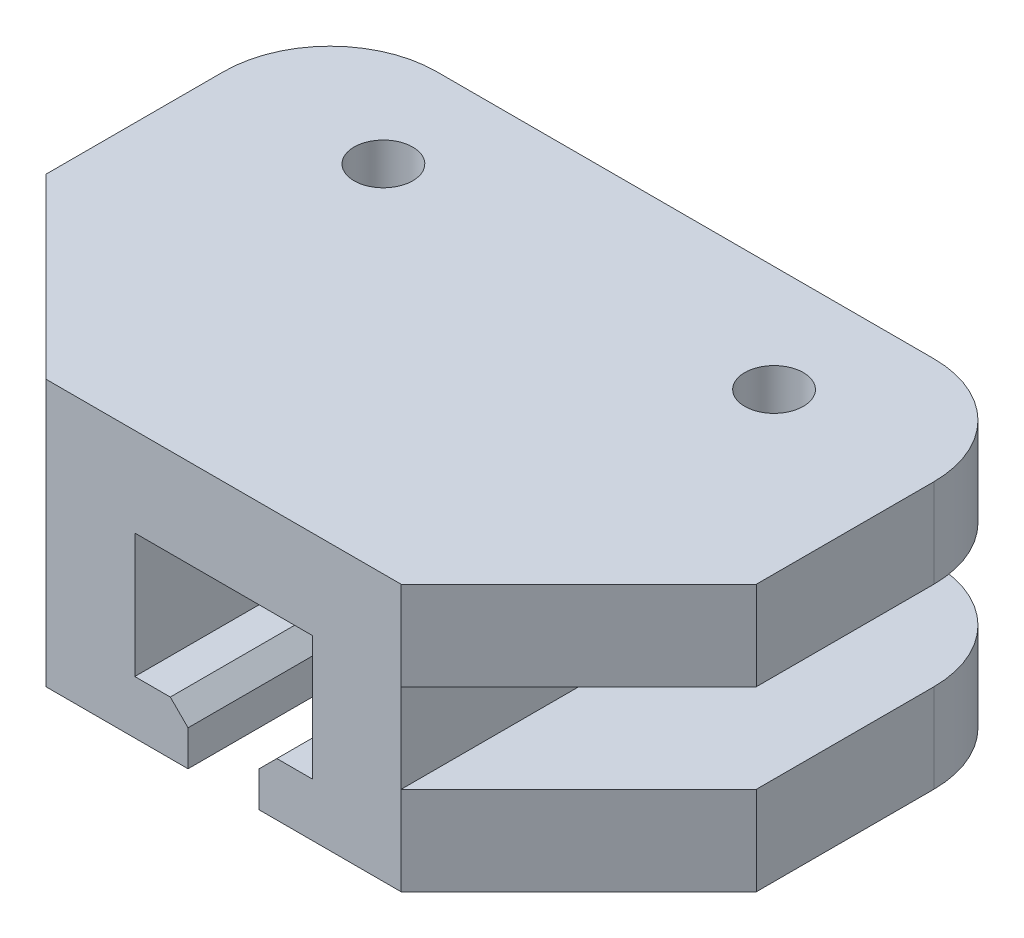
from build123d import *

# Parameters (mm, degrees)
SKETCH_1_W                = 20
SKETCH_1_H                = 20
SKETCH_1_W_2              = 10
SKETCH_1_H_2              = 10
EXTRUDE_1_DEPTH           = 30
EXTRUDE_1_2_DEPTH         = 20
EXTRUDE_1_2_DEPTH_BACK    = 40
SKETCH_2_W                = 20
SKETCH_2_H                = 20
SKETCH_5_W                = 20
SKETCH_5_H                = 10
CUT_EXTRUDE_1_DEPTH       = 35
SKETCH_6_R                = 1.5
CUT_EXTRUDE_2_DEPTH       = 35
SKETCH_7_W                = 10
SKETCH_7_H                = 10
CUT_EXTRUDE_3_DEPTH       = 35
SKETCH_8_W                = 20
SKETCH_8_H                = 20
CUT_EXTRUDE_4_DEPTH       = 23
SKETCH_10_W               = 20
SKETCH_10_H               = 20
CUT_EXTRUDE_5_DEPTH       = 5
CHAMFER_1_SIZE            = 10
SKETCH_12_W               = 20
SKETCH_12_H               = 15
CUT_EXTRUDE_6_DEPTH       = 5
SKETCH_13_W               = 10
SKETCH_13_H               = 20
CUT_EXTRUDE_7_DEPTH       = 5
SKETCH_14_W               = 40
SKETCH_14_H               = 20
EXTRUDE_4_DEPTH           = 10
SKETCH_15_W               = 10
SKETCH_15_H               = 5
CUT_EXTRUDE_8_DEPTH       = 37
CHAMFER_2_SIZE            = 10
CUT_EXTRUDE_9_DEPTH       = 37
CUT_EXTRUDE_9_DEPTH_BACK  = 10
SKETCH_16_R               = 1.65
SKETCH_18_W               = 40
SKETCH_18_H               = 4
CUT_EXTRUDE_10_DEPTH      = 35
SKETCH_19_W               = 10
SKETCH_19_H               = 8
EXTRUDE_5_DEPTH           = 10
SKETCH_20_R               = 1.5
CUT_EXTRUDE_11_DEPTH      = 30
FILLET_1_R                = 6
SKETCH_21_W               = 10
SKETCH_21_H               = 12
CUT_EXTRUDE_12_DEPTH      = 1
CUT_EXTRUDE_13_DEPTH      = 18
CUT_EXTRUDE_13_DEPTH_BACK = 5
SKETCH_23_W               = 60.486113846
SKETCH_23_H               = 38.876717581
SKETCH_24_W               = 3
SKETCH_24_H               = 3
EXTRUDE_6_DEPTH           = 25
CHAMFER_3_SIZE            = 3
CHAMFER_4_SIZE            = 1
CHAMFER_5_SIZE            = 3


# Some blends are built 0.0001 mm under size
with BuildPart() as part:
    # 草图1 → Extrude 1 (new body)
    with BuildSketch(Plane.XY):
        with Locations((-10, 10)):
            Rectangle(SKETCH_1_W, SKETCH_1_H)
        with Locations((-10, 10)):
            Rectangle(SKETCH_1_W_2, SKETCH_1_H_2, mode=Mode.SUBTRACT)
    extrude(amount=EXTRUDE_1_DEPTH)

    # 草图2 → Extrude 1 2 (add, two sides: drawn at the far end of the back side and taken through both)
    with BuildSketch(Plane(origin=(0, 0, 0), x_dir=(0, 0, -1), z_dir=(1, 0, 0)).offset(-EXTRUDE_1_2_DEPTH_BACK)):
        with Locations((-10, 20)):
            Rectangle(SKETCH_2_W, SKETCH_2_H)
    extrude(amount=EXTRUDE_1_2_DEPTH + EXTRUDE_1_2_DEPTH_BACK)

    # 草图5 → 切除-拉伸1 (cut)
    with BuildSketch(Plane.XY.offset(20)):
        with Locations((-30, 25)):
            Rectangle(SKETCH_5_W, SKETCH_5_H)
        with Locations((10, 25)):
            Rectangle(SKETCH_5_W, SKETCH_5_H)
    extrude(amount=-CUT_EXTRUDE_1_DEPTH, mode=Mode.SUBTRACT)

    # 草图6 → 切除-拉伸2 (cut)
    with BuildSketch(Plane(origin=(0, 30, 0), x_dir=(1, 0, 0), z_dir=(0, 1, 0))):
        with Locations(Location((-21, -10, 0), (0, 0, 311.810314896))):
            Circle(SKETCH_6_R)
        with Locations(Location((1, -10, 0), (0, 0, 228.189685104))):
            Circle(SKETCH_6_R)
    extrude(amount=-CUT_EXTRUDE_2_DEPTH, mode=Mode.SUBTRACT)

    # 草图7 → 切除-拉伸3 (cut)
    with BuildSketch(Plane.XY.offset(30)):
        with Locations((-10, 10)):
            Rectangle(SKETCH_7_W, SKETCH_7_H)
    extrude(amount=-CUT_EXTRUDE_3_DEPTH, mode=Mode.SUBTRACT)

    # 草图8 → 切除-拉伸4 (cut)
    with BuildSketch(Plane(origin=(0, 20, 0), x_dir=(1, 0, 0), z_dir=(0, 1, 0))):
        with Locations((-10, -10)):
            Rectangle(SKETCH_8_W, SKETCH_8_H)
    extrude(amount=CUT_EXTRUDE_4_DEPTH, mode=Mode.SUBTRACT)

    # 草图10 → 切除-拉伸5 (cut)
    with BuildSketch(Plane.XZ.offset(-10)):
        with Locations((-30, 10)):
            Rectangle(SKETCH_10_W, SKETCH_10_H)
        with Locations((10, 10)):
            Rectangle(SKETCH_10_W, SKETCH_10_H)
    extrude(amount=-CUT_EXTRUDE_5_DEPTH, mode=Mode.SUBTRACT)

    # 倒角1
    chamfer_1_edges = [part.edges().sort_by_distance(p)[0] for p in [
        (0, 17.5, 20),
        (-20, 17.5, 20),
    ]]
    chamfer(chamfer_1_edges, length=CHAMFER_1_SIZE - 0.0001)  # a hair under: the kernel refuses the full size

    # 草图12 → 切除-拉伸6 (cut)
    with BuildSketch(Plane.XZ.offset(-15)):
        with Locations((-10, 7.5)):
            Rectangle(SKETCH_12_W, SKETCH_12_H)
    extrude(amount=CUT_EXTRUDE_6_DEPTH, mode=Mode.SUBTRACT)

    # 草图13 → 切除-拉伸7 (cut)
    with BuildSketch(Plane.XZ.offset(-15)):
        with Locations((-35, 10)):
            Rectangle(SKETCH_13_W, SKETCH_13_H)
        with Locations((15, 10)):
            Rectangle(SKETCH_13_W, SKETCH_13_H)
    extrude(amount=-CUT_EXTRUDE_7_DEPTH, mode=Mode.SUBTRACT)

    # 草图14 → 凸台-拉伸4 (add)
    with BuildSketch(Plane.XZ):
        with Locations((-10, 10)):
            Rectangle(SKETCH_14_W, SKETCH_14_H)
    extrude(amount=-EXTRUDE_4_DEPTH)

    # 草图15 → 切除-拉伸8 (cut)
    with BuildSketch(Plane.XY.offset(30)):
        with Locations((-10, 7.5)):
            Rectangle(SKETCH_15_W, SKETCH_15_H)
    extrude(amount=-CUT_EXTRUDE_8_DEPTH, mode=Mode.SUBTRACT)

    # 倒角2
    chamfer_2_edges = [part.edges().sort_by_distance(p)[0] for p in [
        (0, 5, 20),
        (-20, 5, 20),
    ]]
    chamfer(chamfer_2_edges, length=CHAMFER_2_SIZE - 0.0001)  # a hair under: the kernel refuses the full size

    # 草图16 → 切除-拉伸9 (cut, two sides: drawn at the far end of the back side and taken through both)
    with BuildSketch(Plane(origin=(0, 10, 0), x_dir=(1, 0, 0), z_dir=(0, 1, 0)).offset(-CUT_EXTRUDE_9_DEPTH_BACK)):
        with Locations(Location((-21, -10, 0), (0, 0, 90))):
            Circle(SKETCH_16_R)
        with Locations(Location((1, -10, 0), (0, 0, 90))):
            Circle(SKETCH_16_R)
    extrude(amount=CUT_EXTRUDE_9_DEPTH + CUT_EXTRUDE_9_DEPTH_BACK, mode=Mode.SUBTRACT)

    # 草图18 → 切除-拉伸10 (cut)
    with BuildSketch(Plane(origin=(0, 20, 0), x_dir=(1, 0, 0), z_dir=(0, 1, 0))):
        with Locations((-10, -2)):
            Rectangle(SKETCH_18_W, SKETCH_18_H)
    extrude(amount=-CUT_EXTRUDE_10_DEPTH, mode=Mode.SUBTRACT)

    # 草图19 → 凸台-拉伸5 (add)
    with BuildSketch(Plane.XZ):
        with Locations((-10, 20)):
            Rectangle(SKETCH_19_W, SKETCH_19_H)
    extrude(amount=EXTRUDE_5_DEPTH)

    # 草图20 → 切除-拉伸11 (cut)
    with BuildSketch(Plane.ZY.offset(15)):
        with Locations((20, -3)):
            Circle(SKETCH_20_R)
    extrude(amount=-CUT_EXTRUDE_11_DEPTH, mode=Mode.SUBTRACT)

    # 圆角1
    fillet_1_edges = [part.edges().sort_by_distance(p)[0] for p in [
        (-30, 5, 4),
        (10, 5, 4),
        (-30, 17.5, 4),
        (10, 17.5, 4),
    ]]
    fillet(fillet_1_edges, radius=FILLET_1_R)

    # 草图21 → 切除-拉伸12 (cut)
    with BuildSketch(Plane.XZ):
        with Locations((-10, 10)):
            Rectangle(SKETCH_21_W, SKETCH_21_H)
    extrude(amount=-CUT_EXTRUDE_12_DEPTH, mode=Mode.SUBTRACT)

    # 草图23 → 切除-拉伸13 (cut, two sides: drawn at the far end of the back side and taken through both)
    with BuildSketch(Plane.XZ.offset(-CUT_EXTRUDE_13_DEPTH_BACK)):
        with Locations((-10.757338654, 16.810917803)):
            Rectangle(SKETCH_23_W, SKETCH_23_H)
    extrude(amount=CUT_EXTRUDE_13_DEPTH + CUT_EXTRUDE_13_DEPTH_BACK, mode=Mode.SUBTRACT)

    # 草图24 → 凸台-拉伸6 (add)
    with BuildSketch(Plane.XY.offset(30)):
        with Locations((-13.5, 6.5)):
            Rectangle(SKETCH_24_W, SKETCH_24_H)
        with Locations((-6.5, 6.5)):
            Rectangle(SKETCH_24_W, SKETCH_24_H)
    extrude(amount=-EXTRUDE_6_DEPTH)

    # 倒角3
    # the kernel refuses this chamfer: 3 mm, written as the material it adds along each edge
    with BuildSketch(Plane(origin=(-5, 8, 5), x_dir=(0.02749587661058649, 0, -0.9996219169112968), z_dir=(0, -1, 0))) as chamfer_3_piece_1_section:
        Polygon((CHAMFER_3_SIZE * 0.999621916911, -CHAMFER_3_SIZE * 0.0274958766106), (-CHAMFER_3_SIZE * 0.0274958766106, -CHAMFER_3_SIZE * 0.999621916911), (0, 0), align=None)
    chamfer_3_piece_1 = extrude(amount=3, mode=Mode.PRIVATE)
    chamfer_3_piece_1 = split(chamfer_3_piece_1, bisect_by=Plane(origin=(-6.280814641, 6.5, 4), z_dir=(0, 0, 1)), keep=Keep.TOP, mode=Mode.PRIVATE)
    chamfer_3_piece_1 = split(chamfer_3_piece_1, bisect_by=Plane(origin=(-8, 6.5, 4.572987798), z_dir=(1, 0, 0)), keep=Keep.TOP, mode=Mode.PRIVATE)
    add(chamfer_3_piece_1)
    with BuildSketch(Plane(origin=(-15, 8, 5), x_dir=(-0.027495876610586202, 0, -0.9996219169112968), z_dir=(0, -1, 0))) as chamfer_3_piece_2_section:
        Polygon((CHAMFER_3_SIZE * 0.999621916911, CHAMFER_3_SIZE * 0.0274958766106), (-CHAMFER_3_SIZE * 0.0274958766106, CHAMFER_3_SIZE * 0.999621916911), (0, 0), align=None)
    chamfer_3_piece_2 = extrude(amount=3, mode=Mode.PRIVATE)
    chamfer_3_piece_2 = split(chamfer_3_piece_2, bisect_by=Plane(origin=(-13.719185359, 6.5, 4), z_dir=(0, 0, 1)), keep=Keep.TOP, mode=Mode.PRIVATE)
    chamfer_3_piece_2 = split(chamfer_3_piece_2, bisect_by=Plane(origin=(-12, 6.5, 4.572987798), z_dir=(-1, 0, 0)), keep=Keep.TOP, mode=Mode.PRIVATE)
    add(chamfer_3_piece_2)

    # 倒角4
    chamfer_4_edges = [part.edges().sort_by_distance(p)[0] for p in [
        (-12, 8, 17.5),
        (-8, 8, 17.5),
    ]]
    chamfer(chamfer_4_edges, length=CHAMFER_4_SIZE)

    # 倒角5
    chamfer_5_edges = [part.edges().sort_by_distance(p)[0] for p in [
        (0, 12.5, 15),
        (-20, 12.5, 15),
    ]]
    chamfer(chamfer_5_edges, length=CHAMFER_5_SIZE)


solid = part.part
